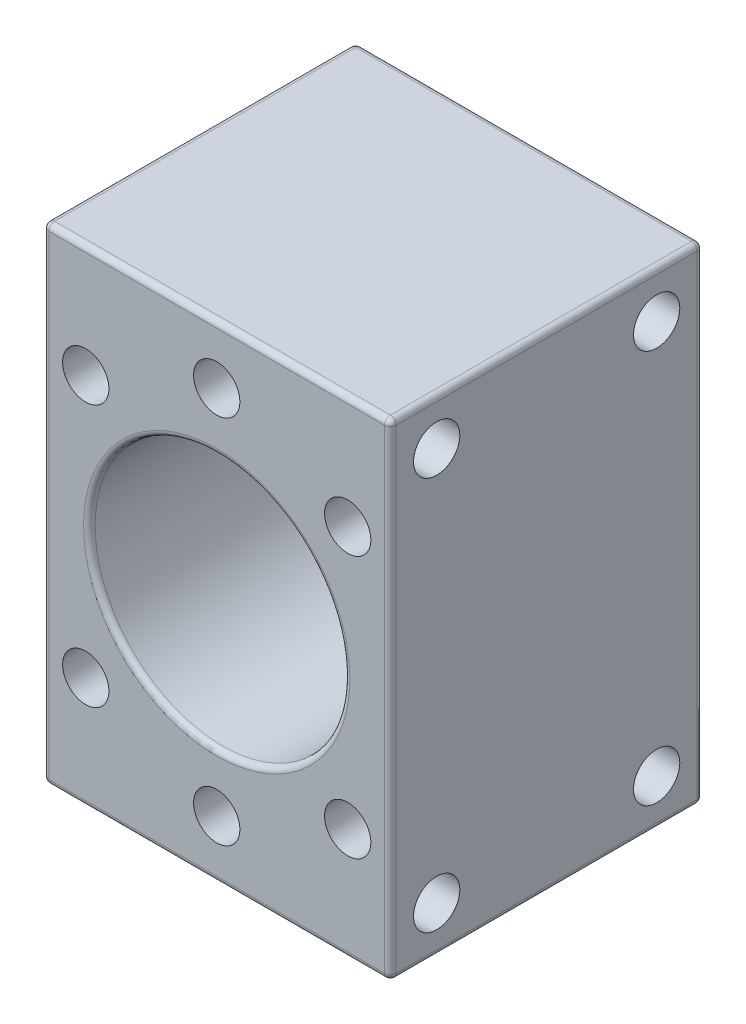
from build123d import *

# Parameters (mm, degrees)
SKETCH1_W           = 30
SKETCH1_H           = 42
BOSS_EXTRUDE1_DEPTH = 13.5
SKETCH2_R           = 11
CUT_EXTRUDE1_DEPTH  = 38.349698794
SKETCH3_R           = 2
CUT_EXTRUDE2_DEPTH  = 8
SKETCH6_R           = 2
CUT_EXTRUDE3_DEPTH  = 8
FILLET1_R           = 0.5


with BuildPart() as part:
    # Sketch1 → Boss-Extrude1 (new, symmetric)
    with BuildSketch(Plane.XY):
        Rectangle(SKETCH1_W, SKETCH1_H)
    extrude(amount=BOSS_EXTRUDE1_DEPTH, both=True)

    # Sketch2 → Cut-Extrude1 (cut, through all)
    with BuildSketch(Plane.XY.offset(13.5)):
        Circle(SKETCH2_R)
    extrude(amount=-CUT_EXTRUDE1_DEPTH, mode=Mode.SUBTRACT)

    # Sketch3 → Cut-Extrude2 (cut)
    with BuildSketch(Plane.XY.offset(13.5)):
        with Locations((-11.313708499, 11.313708499)):
            Circle(SKETCH3_R)
        with Locations((0, 16)):
            Circle(SKETCH3_R)
        with Locations((11.313708499, 11.313708499)):
            Circle(SKETCH3_R)
        with Locations((11.313708499, -11.313708499)):
            Circle(SKETCH3_R)
        with Locations((0, -16)):
            Circle(SKETCH3_R)
        with Locations((-11.313708499, -11.313708499)):
            Circle(SKETCH3_R)
    extrude(amount=-CUT_EXTRUDE2_DEPTH, mode=Mode.SUBTRACT)

    # Sketch6 → Cut-Extrude3 (cut)
    with BuildSketch(Plane(origin=(15, 0, 0), x_dir=(0, 0, -1), z_dir=(1, 0, 0))):
        with Locations((9.5, 17)):
            Circle(SKETCH6_R)
        with Locations((-9.5, 17)):
            Circle(SKETCH6_R)
        with Locations((9.5, -17)):
            Circle(SKETCH6_R)
        with Locations((-9.5, -17)):
            Circle(SKETCH6_R)
    extrude(amount=-CUT_EXTRUDE3_DEPTH, mode=Mode.SUBTRACT)

    # Fillet1
    fillet1_edges = [part.edges().sort_by_distance(p)[0] for p in [
        (0, -21, -13.5),
        (-15, -21, 0),
        (15, 0, -13.5),
        (15, -21, 0),
        (0, -21, 13.5),
        (-15, 0, 13.5),
        (-11, 0, 13.5),
        (15, 0, 13.5),
        (-15, 21, 0),
        (0, 21, -13.5),
        (15, 21, 0),
        (0, 21, 13.5),
        (-11, 0, -13.5),
        (-15, 0, -13.5),
    ]]
    fillet(fillet1_edges, radius=FILLET1_R)


solid = part.part
